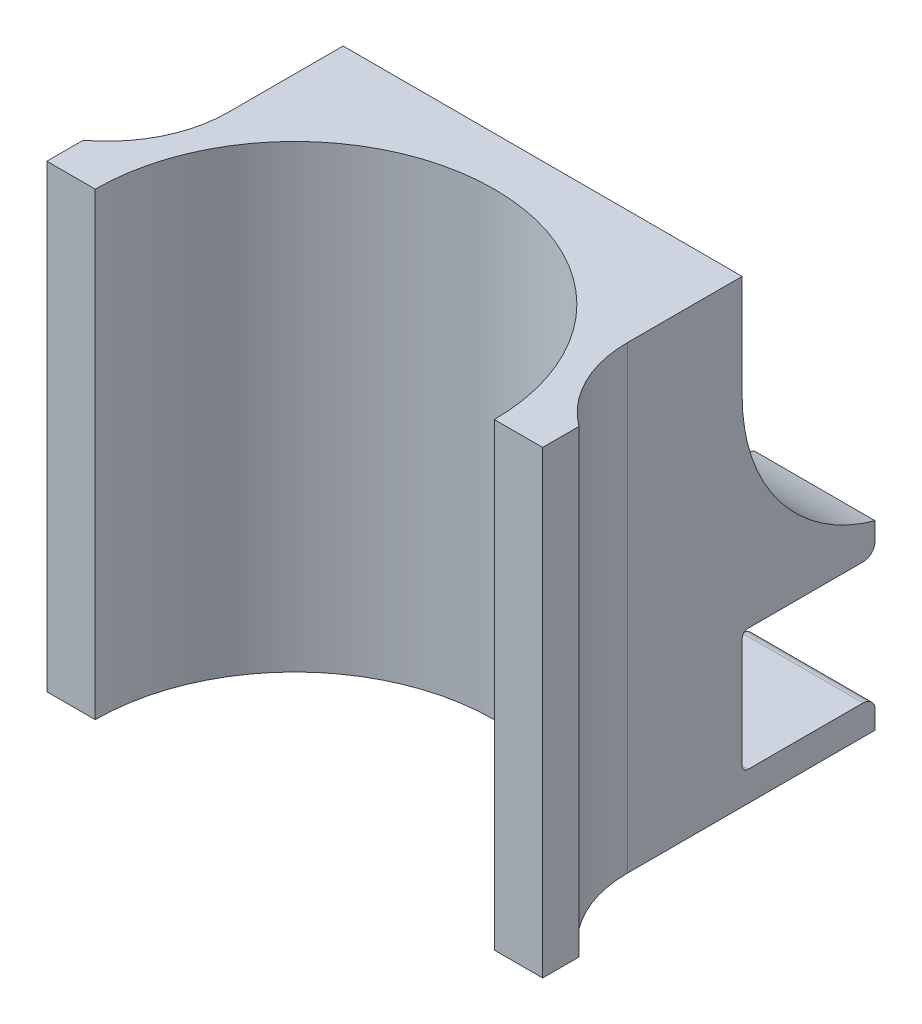
from build123d import *

# Parameters (mm, degrees)
SKETCH1_W           = 8
SKETCH1_H           = 6
SKETCH1_W_2         = 20
SKETCH1_H_2         = 22
BOSS_EXTRUDE1_DEPTH = 30
SKETCH2_W           = 66
SKETCH2_H           = 20.2
CUT_EXTRUDE1_DEPTH  = 22
SKETCH3_W           = 8
SKETCH3_H           = 6
BOSS_EXTRUDE2_DEPTH = 46
FILLET1_R           = 30
FILLET2_R           = 20
FILLET3_R           = 10
FILLET4_R           = 2
FILLET5_R           = 1


with BuildPart() as part:
    # Sketch1 → Boss-Extrude1 (new body)
    with BuildSketch(Plane(origin=(0, 0, 0), x_dir=(1, 0, 0), z_dir=(0, 1, 0))):
        with BuildLine():
            Line((-13, 41), (-33, 41))
            Line((-33, 41), (-33, 6))
            Line((-33, 6), (-32.449961479, 6))
            ThreePointArc((-32.449961479, 6), (0, 33), (32.449961479, 6))
            Line((32.449961479, 6), (33, 6))
            Line((33, 6), (33, 41))
            Line((33, 41), (13, 41))
            Line((13, 41), (-13, 41))
        make_face()
        with Locations((-37, 3)):
            Rectangle(SKETCH1_W, SKETCH1_H)
        with BuildLine():
            Line((-32.449961479, 6), (-33, 6))
            Line((-33, 6), (-33, 0))
            ThreePointArc((-33, 0), (-32.862202671, 3.012579558), (-32.449961479, 6))
        make_face()
        with Locations((37, 3)):
            Rectangle(SKETCH1_W, SKETCH1_H)
        with BuildLine():
            ThreePointArc((32.449961479, 6), (32.862202671, 3.012579558), (33, 0))
            Line((33, 0), (33, 6))
            Line((33, 6), (32.449961479, 6))
        make_face()
        with Locations((-23, 52)):
            Rectangle(SKETCH1_W_2, SKETCH1_H_2)
        with Locations((23, 52)):
            Rectangle(SKETCH1_W_2, SKETCH1_H_2)
    extrude(amount=BOSS_EXTRUDE1_DEPTH)

    # Sketch2 → Cut-Extrude1 (cut)
    with BuildSketch(Plane(origin=(0, 0, -63), x_dir=(-1, 0, 0), z_dir=(0, 0, -1))):
        with Locations((0, 15)):
            Rectangle(SKETCH2_W, SKETCH2_H)
    extrude(amount=-CUT_EXTRUDE1_DEPTH, mode=Mode.SUBTRACT)

    # Sketch3 → Boss-Extrude2 (add)
    with BuildSketch(Plane(origin=(0, 30, 0), x_dir=(1, 0, 0), z_dir=(0, 1, 0))):
        with BuildLine():
            Line((-33, 41), (-33, 6))
            Line((-33, 6), (-32.449961479, 6))
            ThreePointArc((-32.449961479, 6), (0, 33), (32.449961479, 6))
            Line((32.449961479, 6), (33, 6))
            Line((33, 6), (33, 41))
            Line((33, 41), (13, 41))
            Line((13, 41), (-13, 41))
            Line((-13, 41), (-33, 41))
        make_face()
        with Locations((37, 3)):
            Rectangle(SKETCH3_W, SKETCH3_H)
        with Locations((-37, 3)):
            Rectangle(SKETCH3_W, SKETCH3_H)
        with BuildLine():
            Line((-32.449961479, 6), (-33, 6))
            Line((-33, 6), (-33, 0))
            ThreePointArc((-33, 0), (-32.862202671, 3.012579558), (-32.449961479, 6))
        make_face()
        with BuildLine():
            Line((33, 6), (32.449961479, 6))
            ThreePointArc((32.449961479, 6), (32.862202671, 3.012579558), (33, 0))
            Line((33, 0), (33, 6))
        make_face()
    extrude(amount=BOSS_EXTRUDE2_DEPTH)

    # Fillet1
    # the kernel refuses this fillet: 30 mm, written as the material it adds along each edge
    with BuildSketch(Plane(origin=(59.284161474, 30, -41), x_dir=(0, 1, 0), z_dir=(-1, 0, 0))) as fillet1_piece_1_section:
        with BuildLine():
            CenterArc((28.91366459, 30), FILLET1_R, 195.466009953, 74.533990047)
            Line((0, 22), (-0.578273292, 21.84))
            ThreePointArc((-0.578273292, 21.84), (-0.6, 11), (-0.6, 0))
            Line((-0.6, 0), (0, -0.6))
            Line((0, -0.6), (28.91366459, -0.6))
            Line((28.91366459, -0.6), (28.91366459, 0))
        make_face()
    fillet1_piece_1 = extrude(amount=92.284161474, mode=Mode.PRIVATE)
    fillet1_piece_1 = split(fillet1_piece_1, bisect_by=Plane(origin=(33, 36.836030265, -46.582233156), z_dir=(-1, 0, 0)), keep=Keep.TOP, mode=Mode.PRIVATE)
    fillet1_piece_1 = split(fillet1_piece_1, bisect_by=Plane(origin=(13, 36.836030265, -46.582233156), z_dir=(1, 0, 0)), keep=Keep.TOP, mode=Mode.PRIVATE)
    add(fillet1_piece_1)
    with BuildSketch(Plane(origin=(-13, 30, -41), x_dir=(0, 1, 0), z_dir=(-1, 0, 0)), Plane(origin=(33, 30, -41), x_dir=(0, 1, 0), z_dir=(-1, 0, 0))) as fillet1_piece_2:
        with BuildLine():
            CenterArc((28.91366459, 30), FILLET1_R, 195.466009953, 74.533990047)
            Line((0, 22), (-0.578273292, 21.84))
            ThreePointArc((-0.578273292, 21.84), (-0.6, 11), (-0.6, 0))
            Line((-0.6, 0), (0, -0.6))
            Line((0, -0.6), (28.91366459, -0.6))
            Line((28.91366459, -0.6), (28.91366459, 0))
        make_face()
    extrude(amount=20)
    with BuildSketch(Plane(origin=(33, 30, -41), x_dir=(0, 1, 0), z_dir=(-1, 0, 0))) as fillet1_piece_3_section:
        with BuildLine():
            CenterArc((28.91366459, 30), FILLET1_R, 195.466009953, 74.533990047)
            Line((0, 22), (-0.578273292, 21.84))
            ThreePointArc((-0.578273292, 21.84), (-0.6, 11), (-0.6, 0))
            Line((-0.6, 0), (0, -0.6))
            Line((0, -0.6), (28.91366459, -0.6))
            Line((28.91366459, -0.6), (28.91366459, 0))
        make_face()
    fillet1_piece_3 = extrude(amount=92.284161474, mode=Mode.PRIVATE)
    fillet1_piece_3 = split(fillet1_piece_3, bisect_by=Plane(origin=(-33, 36.836030265, -46.582233156), z_dir=(1, 0, 0)), keep=Keep.TOP, mode=Mode.PRIVATE)
    fillet1_piece_3 = split(fillet1_piece_3, bisect_by=Plane(origin=(-13, 36.836030265, -46.582233156), z_dir=(-1, 0, 0)), keep=Keep.TOP, mode=Mode.PRIVATE)
    add(fillet1_piece_3)

    # Fillet2
    # the kernel refuses this fillet: 20 mm, written as the material it adds along each edge
    with BuildSketch(Plane(origin=(33, 76, -6), x_dir=(0, 0, -1), z_dir=(0, -1, 0)), Plane(origin=(-33, 0, -6), x_dir=(0, 0, -1), z_dir=(0, 1, 0))) as fillet2_piece_1:
        with BuildLine():
            CenterArc((16, 20), FILLET2_R, 216.869897646, 53.130102354)
            Line((0, 8), (-0.32, 7.76))
            ThreePointArc((-0.32, 7.76), (-0.4, 4), (-0.4, 0))
            Line((-0.4, 0), (0, -0.4))
            Line((0, -0.4), (16, -0.4))
            Line((16, -0.4), (16, 0))
        make_face()
    extrude(amount=76)

    # Fillet3
    fillet3_edges = [part.edges().sort_by_distance(p)[0] for p in [
        (-13, 42.006832295, -41),
        (13, 2.45, -41),
        (13, 42.006832295, -41),
        (-13, 2.45, -41),
    ]]
    fillet(fillet3_edges, radius=FILLET3_R)

    # Fillet4
    fillet4_edges = [part.edges().sort_by_distance(p)[0] for p in [
        (-23, 25.1, -63),
        (-23, 4.9, -63),
        (23, 25.1, -63),
        (23, 4.9, -63),
    ]]
    fillet(fillet4_edges, radius=FILLET4_R)

    # Fillet5
    fillet5_edges = [part.edges().sort_by_distance(p)[0] for p in [
        (-18, 25.1, -41),
        (-18, 4.9, -41),
        (18, 25.1, -41),
        (18, 4.9, -41),
    ]]
    fillet(fillet5_edges, radius=FILLET5_R)


solid = part.part
